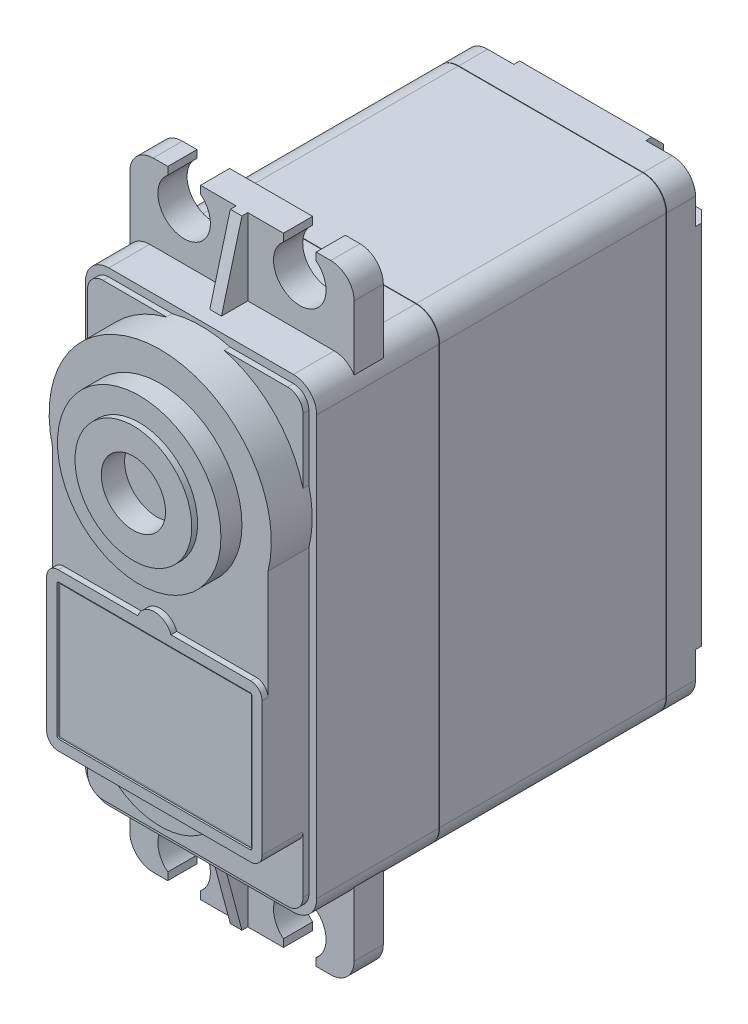
from build123d import *
from OCP.BRepFilletAPI import BRepFilletAPI_MakeChamfer

# Parameters (mm, degrees)
ESTRUSIONE_ESTRUSIONE1_DEPTH  = 4
ESTRUSIONE_ESTRUSIONE2_DEPTH  = 19.44
ESTRUSIONE_ESTRUSIONE3_DEPTH  = 10.5
ESTRUSIONE_ESTRUSIONE4_DEPTH  = 2.5
ESTRUSIONE_ESTRUSIONE5_DEPTH  = 0.5
SCHIZZO8_W                    = 2.518204115
SCHIZZO8_H                    = 5.351796035
TAGLIO_ESTRUSIONE1_DEPTH      = 4.25
RACCORDO1_R                   = 2.5
SMUSSO1_SIZE                  = 1
ESTRUSIONE_ESTRUSIONE6_DEPTH  = 0.5
ESTRUSIONE_ESTRUSIONE7_DEPTH  = 3
ESTRUSIONE_ESTRUSIONE8_DEPTH  = 0.5
SCHIZZO12_R                   = 9.515
ESTRUSIONE_ESTRUSIONE9_DEPTH  = 0.5
TAGLIO_ESTRUSIONE2_DEPTH      = 0.15
SCHIZZO14_R                   = 7
ESTRUSIONE_ESTRUSIONE10_DEPTH = 1.8
SCHIZZO15_R                   = 5
ESTRUSIONE_ESTRUSIONE11_DEPTH = 0.5
SCHIZZO16_R                   = 2.75
TAGLIO_ESTRUSIONE3_DEPTH      = 2
SCHIZZO17_W                   = 16.37936388
SCHIZZO17_H                   = 11.341417051
ESTRUSIONE_ESTRUSIONE12_DEPTH = 0.05
SMUSSO2_SIZE                  = 0.025
SMUSSO2_SIZE2                 = 0.04330127
SMUSSO3_SIZE                  = 0.025
SMUSSO3_SIZE2                 = 0.014433757
SMUSSO4_SIZE                  = 0.025
SMUSSO4_SIZE2                 = 0.014433757
SMUSSO5_SIZE                  = 0.025
SMUSSO5_SIZE2                 = 0.04330127


with BuildPart() as part:
    # Schizzo2 → Estrusione-Estrusione1 (new body)
    with BuildSketch(Plane.XY):
        with BuildLine():
            Line((49.703262128, 79.37022424), (33.893262128, 79.37022424))
            ThreePointArc((33.893262128, 79.37022424), (32.479048566, 78.784437803), (31.893262128, 77.37022424))
            Line((31.893262128, 77.37022424), (31.893262128, 41.490176274))
            ThreePointArc((31.893262128, 41.490176274), (32.479048566, 40.075962712), (33.893262128, 39.490176274))
            Line((33.893262128, 39.490176274), (49.703262128, 39.490176274))
            ThreePointArc((49.703262128, 39.490176274), (51.11747569, 40.075962712), (51.703262128, 41.490176274))
            Line((51.703262128, 41.490176274), (51.703262128, 77.37022424))
            ThreePointArc((51.703262128, 77.37022424), (51.11747569, 78.784437803), (49.703262128, 79.37022424))
        make_face()
    extrude(amount=ESTRUSIONE_ESTRUSIONE1_DEPTH)

    # Schizzo8 → Taglio-Estrusione1 (cut)
    with BuildSketch(Plane(origin=(51.703262128, 0, 0), x_dir=(0, 0, -1), z_dir=(1, 0, 0))):
        with Locations((-0.240897942, 77.796122258)):
            Rectangle(SCHIZZO8_W, SCHIZZO8_H)
        with Locations((-0.240897942, 41.064278257)):
            Rectangle(SCHIZZO8_W, SCHIZZO8_H)
    taglio_estrusione1 = extrude(amount=-TAGLIO_ESTRUSIONE1_DEPTH, mode=Mode.SUBTRACT)

    # Specchia2: Taglio-Estrusione1 across plane
    add(taglio_estrusione1.mirror(Plane(origin=(41.798262128, 0, 0), x_dir=(0, 0, 1), z_dir=(1, 0, 0))), mode=Mode.SUBTRACT)

    # Raccordo1
    raccordo1_edges = [part.edges().sort_by_distance(p)[0] for p in [
        (47.453262128, 75.12022424, 0.75),
        (47.453262128, 43.740176274, 0.75),
        (36.143262128, 75.12022424, 0.75),
        (36.143262128, 43.740176274, 0.75),
    ]]
    fillet(raccordo1_edges, radius=RACCORDO1_R)

    # Smusso1
    smusso1_edges = [part.edges().sort_by_distance(p)[0] for p in [
        (41.798262128, 79.37022424, 0),
        (51.703262128, 59.430200257, 0),
        (31.893262128, 59.430200257, 0),
        (41.798262128, 39.490176274, 0),
    ]]
    chamfer(smusso1_edges, length=SMUSSO1_SIZE)

    # Smusso2: one chamfer whose edges measure the first distance from different faces: ONE call of the kernel's chamfer builder (chamfer() names one face for all edges)
    smusso2_edges_1 = [part.edges().sort_by_distance(p)[0] for p in [
        (32.479048566, 40.075962712, 4),
    ]]
    smusso2_side_1 = [part.faces().sort_by_distance(p)[0] for p in [
        (32.479048566, 40.075962712, 2.75),
    ]]
    smusso2_edges_2 = [part.edges().sort_by_distance(p)[0] for p in [
        (41.798262128, 39.490176274, 4),
    ]]
    smusso2_side_2 = [part.faces().sort_by_distance(p)[0] for p in [
        (41.798262128, 39.490176274, 2.562250996),
    ]]
    smusso2_edges_3 = [part.edges().sort_by_distance(p)[0] for p in [
        (51.11747569, 40.075962712, 4),
    ]]
    smusso2_side_3 = [part.faces().sort_by_distance(p)[0] for p in [
        (51.11747569, 40.075962712, 2.75),
    ]]
    smusso2_edges_4 = [part.edges().sort_by_distance(p)[0] for p in [
        (51.703262128, 59.430200257, 4),
    ]]
    smusso2_side_4 = [part.faces().sort_by_distance(p)[0] for p in [
        (51.703262128, 59.430200257, 2.526686556),
    ]]
    smusso2_edges_5 = [part.edges().sort_by_distance(p)[0] for p in [
        (51.11747569, 78.784437803, 4),
    ]]
    smusso2_side_5 = [part.faces().sort_by_distance(p)[0] for p in [
        (51.11747569, 78.784437803, 2.75),
    ]]
    smusso2_edges_6 = [part.edges().sort_by_distance(p)[0] for p in [
        (41.798262128, 79.37022424, 4),
    ]]
    smusso2_side_6 = [part.faces().sort_by_distance(p)[0] for p in [
        (41.798262128, 79.37022424, 2.562250996),
    ]]
    smusso2_edges_7 = [part.edges().sort_by_distance(p)[0] for p in [
        (32.479048566, 78.784437803, 4),
    ]]
    smusso2_side_7 = [part.faces().sort_by_distance(p)[0] for p in [
        (32.479048566, 78.784437803, 2.75),
    ]]
    smusso2_edges_8 = [part.edges().sort_by_distance(p)[0] for p in [
        (31.893262128, 59.430200257, 4),
    ]]
    smusso2_side_8 = [part.faces().sort_by_distance(p)[0] for p in [
        (31.893262128, 59.430200257, 2.526686556),
    ]]
    smusso2 = BRepFilletAPI_MakeChamfer(part.part.solid().wrapped)
    for e in smusso2_edges_1:
        smusso2.Add(SMUSSO2_SIZE, SMUSSO2_SIZE2, e.wrapped, smusso2_side_1[0].wrapped)  # the first distance lies on this face
    for e in smusso2_edges_2:
        smusso2.Add(SMUSSO2_SIZE, SMUSSO2_SIZE2, e.wrapped, smusso2_side_2[0].wrapped)  # the first distance lies on this face
    for e in smusso2_edges_3:
        smusso2.Add(SMUSSO2_SIZE, SMUSSO2_SIZE2, e.wrapped, smusso2_side_3[0].wrapped)  # the first distance lies on this face
    for e in smusso2_edges_4:
        smusso2.Add(SMUSSO2_SIZE, SMUSSO2_SIZE2, e.wrapped, smusso2_side_4[0].wrapped)  # the first distance lies on this face
    for e in smusso2_edges_5:
        smusso2.Add(SMUSSO2_SIZE, SMUSSO2_SIZE2, e.wrapped, smusso2_side_5[0].wrapped)  # the first distance lies on this face
    for e in smusso2_edges_6:
        smusso2.Add(SMUSSO2_SIZE, SMUSSO2_SIZE2, e.wrapped, smusso2_side_6[0].wrapped)  # the first distance lies on this face
    for e in smusso2_edges_7:
        smusso2.Add(SMUSSO2_SIZE, SMUSSO2_SIZE2, e.wrapped, smusso2_side_7[0].wrapped)  # the first distance lies on this face
    for e in smusso2_edges_8:
        smusso2.Add(SMUSSO2_SIZE, SMUSSO2_SIZE2, e.wrapped, smusso2_side_8[0].wrapped)  # the first distance lies on this face
    add(Compound.cast(smusso2.Shape()), mode=Mode.REPLACE)


with BuildPart() as body_2:
    # Schizzo3 → Estrusione-Estrusione2 (new body)
    with BuildSketch(Plane.XY.offset(4)):
        with BuildLine():
            Line((31.893262128, 77.37022424), (31.893262128, 41.490176274))
            ThreePointArc((31.893262128, 41.490176274), (32.479048566, 40.075962712), (33.893262128, 39.490176274))
            Line((33.893262128, 39.490176274), (49.703262128, 39.490176274))
            ThreePointArc((49.703262128, 39.490176274), (51.11747569, 40.075962712), (51.703262128, 41.490176274))
            Line((51.703262128, 41.490176274), (51.703262128, 77.37022424))
            ThreePointArc((51.703262128, 77.37022424), (51.11747569, 78.784437803), (49.703262128, 79.37022424))
            Line((49.703262128, 79.37022424), (33.893262128, 79.37022424))
            ThreePointArc((33.893262128, 79.37022424), (32.479048566, 78.784437803), (31.893262128, 77.37022424))
        make_face()
    extrude(amount=ESTRUSIONE_ESTRUSIONE2_DEPTH)

    # Smusso3
    smusso3_edges = [body_2.edges().sort_by_distance(p)[0] for p in [
        (31.893262128, 59.430200257, 4),
        (32.479048566, 78.784437803, 4),
        (41.798262128, 79.37022424, 4),
        (51.11747569, 78.784437803, 4),
        (51.703262128, 59.430200257, 4),
        (51.11747569, 40.075962712, 4),
        (41.798262128, 39.490176274, 4),
        (32.479048566, 40.075962712, 4),
    ]]
    smusso3_side = [body_2.faces().sort_by_distance(p)[0] for p in [
        (41.798262128, 59.430200257, 4),
    ]]
    chamfer(smusso3_edges, length=SMUSSO3_SIZE, length2=SMUSSO3_SIZE2, reference=smusso3_side[0])

    # Smusso5: one chamfer whose edges measure the first distance from different faces: ONE call of the kernel's chamfer builder (chamfer() names one face for all edges)
    smusso5_edges_1 = [body_2.edges().sort_by_distance(p)[0] for p in [
        (32.479048566, 40.075962712, 23.44),
    ]]
    smusso5_side_1 = [body_2.faces().sort_by_distance(p)[0] for p in [
        (32.479048566, 40.075962712, 13.727216878),
    ]]
    smusso5_edges_2 = [body_2.edges().sort_by_distance(p)[0] for p in [
        (41.798262128, 39.490176274, 23.44),
    ]]
    smusso5_side_2 = [body_2.faces().sort_by_distance(p)[0] for p in [
        (41.798262128, 39.490176274, 13.727216878),
    ]]
    smusso5_edges_3 = [body_2.edges().sort_by_distance(p)[0] for p in [
        (51.11747569, 40.075962712, 23.44),
    ]]
    smusso5_side_3 = [body_2.faces().sort_by_distance(p)[0] for p in [
        (51.11747569, 40.075962712, 13.727216878),
    ]]
    smusso5_edges_4 = [body_2.edges().sort_by_distance(p)[0] for p in [
        (51.703262128, 59.430200257, 23.44),
    ]]
    smusso5_side_4 = [body_2.faces().sort_by_distance(p)[0] for p in [
        (51.703262128, 59.430200257, 13.727216878),
    ]]
    smusso5_edges_5 = [body_2.edges().sort_by_distance(p)[0] for p in [
        (51.11747569, 78.784437803, 23.44),
    ]]
    smusso5_side_5 = [body_2.faces().sort_by_distance(p)[0] for p in [
        (51.11747569, 78.784437803, 13.727216878),
    ]]
    smusso5_edges_6 = [body_2.edges().sort_by_distance(p)[0] for p in [
        (41.798262128, 79.37022424, 23.44),
    ]]
    smusso5_side_6 = [body_2.faces().sort_by_distance(p)[0] for p in [
        (41.798262128, 79.37022424, 13.727216878),
    ]]
    smusso5_edges_7 = [body_2.edges().sort_by_distance(p)[0] for p in [
        (32.479048566, 78.784437803, 23.44),
    ]]
    smusso5_side_7 = [body_2.faces().sort_by_distance(p)[0] for p in [
        (32.479048566, 78.784437803, 13.727216878),
    ]]
    smusso5_edges_8 = [body_2.edges().sort_by_distance(p)[0] for p in [
        (31.893262128, 59.430200257, 23.44),
    ]]
    smusso5_side_8 = [body_2.faces().sort_by_distance(p)[0] for p in [
        (31.893262128, 59.430200257, 13.727216878),
    ]]
    smusso5 = BRepFilletAPI_MakeChamfer(body_2.part.solid().wrapped)
    for e in smusso5_edges_1:
        smusso5.Add(SMUSSO5_SIZE, SMUSSO5_SIZE2, e.wrapped, smusso5_side_1[0].wrapped)  # the first distance lies on this face
    for e in smusso5_edges_2:
        smusso5.Add(SMUSSO5_SIZE, SMUSSO5_SIZE2, e.wrapped, smusso5_side_2[0].wrapped)  # the first distance lies on this face
    for e in smusso5_edges_3:
        smusso5.Add(SMUSSO5_SIZE, SMUSSO5_SIZE2, e.wrapped, smusso5_side_3[0].wrapped)  # the first distance lies on this face
    for e in smusso5_edges_4:
        smusso5.Add(SMUSSO5_SIZE, SMUSSO5_SIZE2, e.wrapped, smusso5_side_4[0].wrapped)  # the first distance lies on this face
    for e in smusso5_edges_5:
        smusso5.Add(SMUSSO5_SIZE, SMUSSO5_SIZE2, e.wrapped, smusso5_side_5[0].wrapped)  # the first distance lies on this face
    for e in smusso5_edges_6:
        smusso5.Add(SMUSSO5_SIZE, SMUSSO5_SIZE2, e.wrapped, smusso5_side_6[0].wrapped)  # the first distance lies on this face
    for e in smusso5_edges_7:
        smusso5.Add(SMUSSO5_SIZE, SMUSSO5_SIZE2, e.wrapped, smusso5_side_7[0].wrapped)  # the first distance lies on this face
    for e in smusso5_edges_8:
        smusso5.Add(SMUSSO5_SIZE, SMUSSO5_SIZE2, e.wrapped, smusso5_side_8[0].wrapped)  # the first distance lies on this face
    add(Compound.cast(smusso5.Shape()), mode=Mode.REPLACE)


with BuildPart() as body_3:
    # Schizzo4 → Estrusione-Estrusione3 (new body)
    with BuildSketch(Plane.XY.offset(23.44)):
        with BuildLine():
            Line((31.893262128, 77.37022424), (31.893262128, 41.490176274))
            ThreePointArc((31.893262128, 41.490176274), (32.479048566, 40.075962712), (33.893262128, 39.490176274))
            Line((33.893262128, 39.490176274), (49.703262128, 39.490176274))
            ThreePointArc((49.703262128, 39.490176274), (51.11747569, 40.075962712), (51.703262128, 41.490176274))
            Line((51.703262128, 41.490176274), (51.703262128, 77.37022424))
            ThreePointArc((51.703262128, 77.37022424), (51.11747569, 78.784437803), (49.703262128, 79.37022424))
            Line((49.703262128, 79.37022424), (33.893262128, 79.37022424))
            ThreePointArc((33.893262128, 79.37022424), (32.479048566, 78.784437803), (31.893262128, 77.37022424))
        make_face()
    extrude(amount=ESTRUSIONE_ESTRUSIONE3_DEPTH)


with BuildPart() as body_4:
    # Schizzo5 → Estrusione-Estrusione4 (new body)
    with BuildSketch(Plane.XY.offset(27.94)):
        with BuildLine():
            Line((32.193262128, 83.920176274), (32.193262128, 78.423789615))
            ThreePointArc((32.193262128, 78.423789615), (32.920413412, 79.117669626), (33.893262128, 79.37022424))
            Line((33.893262128, 79.37022424), (49.703262128, 79.37022424))
            ThreePointArc((49.703262128, 79.37022424), (50.676110844, 79.117669626), (51.403262128, 78.423789615))
            Line((51.403262128, 78.423789615), (51.403262128, 83.920176274))
            ThreePointArc((51.403262128, 83.920176274), (50.81747569, 85.334389837), (49.403262128, 85.920176274))
            Line((49.403262128, 85.920176274), (48.151262128, 85.920176274))
            Line((48.151262128, 85.920176274), (48.151262128, 85.26656777))
            ThreePointArc((48.151262128, 85.26656777), (46.751262128, 81.255176274), (45.351262128, 85.26656777))
            Line((45.351262128, 85.26656777), (45.351262128, 85.920176274))
            Line((45.351262128, 85.920176274), (38.245262128, 85.920176274))
            Line((38.245262128, 85.920176274), (38.245262128, 85.26656777))
            ThreePointArc((38.245262128, 85.26656777), (36.845262128, 81.255176274), (35.445262128, 85.26656777))
            Line((35.445262128, 85.26656777), (35.445262128, 85.920176274))
            Line((35.445262128, 85.920176274), (34.193262128, 85.920176274))
            ThreePointArc((34.193262128, 85.920176274), (32.779048566, 85.334389837), (32.193262128, 83.920176274))
        make_face()
    extrude(amount=ESTRUSIONE_ESTRUSIONE4_DEPTH)


with BuildPart() as body_5:
    # Schizzo7 → Estrusione-Estrusione5 (new, symmetric)
    with BuildSketch(Plane(origin=(41.798262128, 0, 0), x_dir=(0, 0, -1), z_dir=(1, 0, 0))):
        Polygon((-30.44, 85.920176274), (-30.94, 85.920176274), (-32.695054358, 79.37022424), (-30.44, 79.37022424), align=None)
    extrude(amount=ESTRUSIONE_ESTRUSIONE5_DEPTH, both=True)


with BuildPart() as body_6:
    # Specchia1: mirrored copy
    add(body_4.part.mirror(Plane.ZX.offset(59.430200257)))


with BuildPart() as body_7:
    # Specchia1 2: mirrored copy
    add(body_5.part.mirror(Plane.ZX.offset(59.430200257)))

    # Abbina1: union body 6, body 3, body 4, body 5
    add(body_6.part)
    add(body_3.part)
    add(body_4.part)
    add(body_5.part)

    # Schizzo9 → Estrusione-Estrusione6 (add)
    with BuildSketch(Plane.XY.offset(33.94)):
        with BuildLine():
            Line((32.569562487, 77.37022424), (32.569562487, 41.490176274))
            ThreePointArc((32.569562487, 41.490176274), (32.957265136, 40.554179282), (33.893262128, 40.166476633))
            Line((33.893262128, 40.166476633), (49.703262128, 40.166476633))
            ThreePointArc((49.703262128, 40.166476633), (50.63925912, 40.554179282), (51.026961769, 41.490176274))
            Line((51.026961769, 41.490176274), (51.026961769, 77.37022424))
            ThreePointArc((51.026961769, 77.37022424), (50.63925912, 78.306221233), (49.703262128, 78.693923881))
            Line((49.703262128, 78.693923881), (33.893262128, 78.693923881))
            ThreePointArc((33.893262128, 78.693923881), (32.957265136, 78.306221233), (32.569562487, 77.37022424))
        make_face()
    extrude(amount=ESTRUSIONE_ESTRUSIONE6_DEPTH)

    # Schizzo10 → Estrusione-Estrusione7 (add)
    with BuildSketch(Plane.XY.offset(34.44)):
        with BuildLine():
            ThreePointArc((32.569562487, 46.374172157), (32.862455706, 45.667065376), (33.569562487, 45.374172157))
            Line((33.569562487, 45.374172157), (37.602547952, 45.374172157))
            ThreePointArc((37.602547952, 45.374172157), (41.809244427, 43.65245508), (46.015940902, 45.374172157))
            Line((46.015940902, 45.374172157), (50.026961769, 45.374172157))
            ThreePointArc((50.026961769, 45.374172157), (50.73406855, 45.667065376), (51.026961769, 46.374172157))
            Line((51.026961769, 46.374172157), (51.026961769, 67.188642671))
            ThreePointArc((51.026961769, 67.188642671), (50.00248289, 74.324510947), (44.268513617, 78.693923881))
            ThreePointArc((44.268513617, 78.693923881), (41.798262128, 79.020176274), (39.328010639, 78.693923881))
            ThreePointArc((39.328010639, 78.693923881), (33.594041366, 74.324510947), (32.569562487, 67.188642671))
            Line((32.569562487, 67.188642671), (32.569562487, 46.374172157))
        make_face()
    extrude(amount=ESTRUSIONE_ESTRUSIONE7_DEPTH)

    # Schizzo11 → Estrusione-Estrusione8 (add)
    with BuildSketch(Plane.XY.offset(37.44)):
        with BuildLine():
            ThreePointArc((32.569562487, 46.374172157), (32.862455706, 45.667065376), (33.569562487, 45.374172157))
            Line((33.569562487, 45.374172157), (37.602547952, 45.374172157))
            Line((37.602547952, 45.374172157), (46.015940902, 45.374172157))
            Line((46.015940902, 45.374172157), (50.026961769, 45.374172157))
            ThreePointArc((50.026961769, 45.374172157), (50.73406855, 45.667065376), (51.026961769, 46.374172157))
            Line((51.026961769, 46.374172157), (51.026961769, 57.815589208))
            ThreePointArc((51.026961769, 57.815589208), (50.73406855, 58.522695989), (50.026961769, 58.815589208))
            Line((50.026961769, 58.815589208), (43.21247569, 58.815589208))
            ThreePointArc((43.21247569, 58.815589208), (41.798262128, 59.815589208), (40.384048566, 58.815589208))
            Line((40.384048566, 58.815589208), (33.569562487, 58.815589208))
            ThreePointArc((33.569562487, 58.815589208), (32.862455706, 58.522695989), (32.569562487, 57.815589208))
            Line((32.569562487, 57.815589208), (32.569562487, 46.374172157))
        make_face()
    extrude(amount=ESTRUSIONE_ESTRUSIONE8_DEPTH)

    # Schizzo12 → Estrusione-Estrusione9 (add)
    with BuildSketch(Plane.XY.offset(33.94)):
        with Locations((41.798262128, 69.505176274)):
            Circle(SCHIZZO12_R)
    extrude(amount=ESTRUSIONE_ESTRUSIONE9_DEPTH)

    # Schizzo13 → Taglio-Estrusione2 (cut)
    with BuildSketch(Plane.XY.offset(37.94)):
        with BuildLine():
            Line((50.148926367, 46.424172157), (50.148926367, 57.765589208))
            ThreePointArc((50.148926367, 57.765589208), (50.104992384, 57.871655225), (49.998926367, 57.915589208))
            Line((49.998926367, 57.915589208), (33.619562487, 57.915589208))
            ThreePointArc((33.619562487, 57.915589208), (33.51349647, 57.871655225), (33.469562487, 57.765589208))
            Line((33.469562487, 57.765589208), (33.469562487, 46.424172157))
            ThreePointArc((33.469562487, 46.424172157), (33.51349647, 46.31810614), (33.619562487, 46.274172157))
            Line((33.619562487, 46.274172157), (49.998926367, 46.274172157))
            ThreePointArc((49.998926367, 46.274172157), (50.104992384, 46.31810614), (50.148926367, 46.424172157))
        make_face()
    extrude(amount=-TAGLIO_ESTRUSIONE2_DEPTH, mode=Mode.SUBTRACT)

    # Schizzo14 → Estrusione-Estrusione10 (add)
    with BuildSketch(Plane.XY.offset(37.44)):
        with Locations((41.798262128, 69.505176274)):
            Circle(SCHIZZO14_R)
    extrude(amount=ESTRUSIONE_ESTRUSIONE10_DEPTH)

    # Schizzo15 → Estrusione-Estrusione11 (add)
    with BuildSketch(Plane.XY.offset(39.24)):
        with Locations((41.798262128, 69.505176274)):
            Circle(SCHIZZO15_R)
    extrude(amount=ESTRUSIONE_ESTRUSIONE11_DEPTH)

    # Schizzo16 → Taglio-Estrusione3 (cut)
    with BuildSketch(Plane.XY.offset(39.74)):
        with Locations((41.798262128, 69.505176274)):
            Circle(SCHIZZO16_R)
    extrude(amount=-TAGLIO_ESTRUSIONE3_DEPTH, mode=Mode.SUBTRACT)

    # Smusso4
    smusso4_edges = [body_7.edges().sort_by_distance(p)[0] for p in [
        (41.798262128, 39.490176274, 23.44),
        (41.798262128, 79.37022424, 23.44),
        (32.479048566, 78.784437803, 23.44),
        (31.893262128, 59.430200257, 23.44),
        (32.479048566, 40.075962712, 23.44),
        (51.11747569, 40.075962712, 23.44),
        (51.703262128, 59.430200257, 23.44),
        (51.11747569, 78.784437803, 23.44),
    ]]
    smusso4_side = [body_7.faces().sort_by_distance(p)[0] for p in [
        (41.798262128, 59.430200257, 23.44),
    ]]
    chamfer(smusso4_edges, length=SMUSSO4_SIZE, length2=SMUSSO4_SIZE2, reference=smusso4_side[0])


with BuildPart() as body_4_2:
    # Schizzo17 → Estrusione-Estrusione12 (new body)
    with BuildSketch(Plane.XY.offset(37.79)):
        with Locations((41.809244427, 52.094880683)):
            Rectangle(SCHIZZO17_W, SCHIZZO17_H)
    extrude(amount=ESTRUSIONE_ESTRUSIONE12_DEPTH)


solid = Compound([part.part, body_2.part, body_7.part, body_4_2.part])
